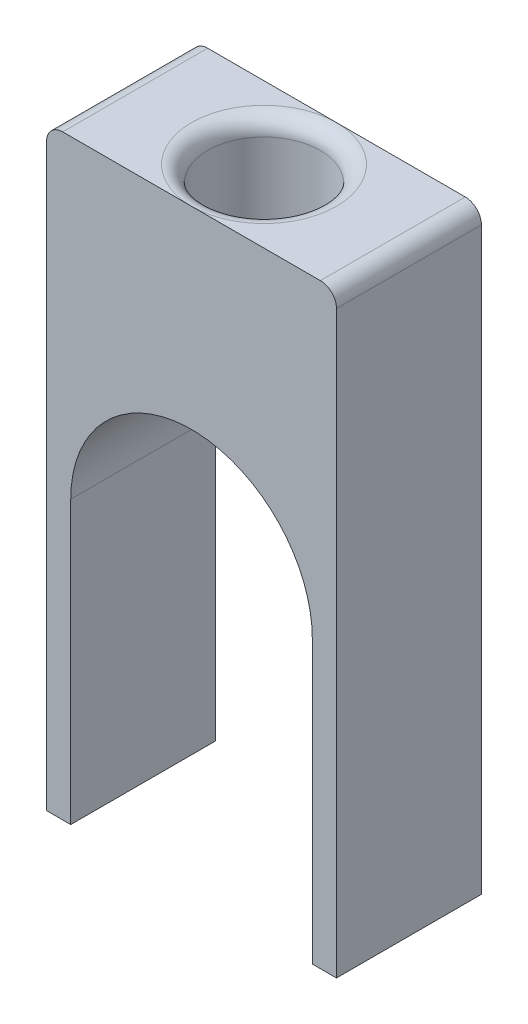
from build123d import *

# Parameters (mm, degrees)
BOSS_EXTRUDE1_DEPTH     = 18
CUT_EXTRUDE1_REACH      = 86.238
CUT_EXTRUDE1_END_RADIUS = 15
SKETCH3_R               = 7
FILLET1_R               = 2
FILLET2_R               = 2


with BuildPart() as part:
    # Sketch2 → Boss-Extrude1 (new body)
    with BuildSketch(Plane.XY):
        with BuildLine():
            Line((-33.38706816, 74), (-36, 74))
            Line((-36, 74), (-36, 0))
            Line((-36, 0), (-33, 0))
            Line((-33, 0), (-33, 35))
            ThreePointArc((-33, 35), (-18, 50), (-3, 35))
            Line((-3, 35), (-3, 0))
            Line((-3, 0), (0, 0))
            Line((0, 0), (0, 74))
            Line((0, 74), (-12.61679677, 74))
            Line((-12.61679677, 74), (-33.38706816, 74))
        make_face()
    extrude(amount=BOSS_EXTRUDE1_DEPTH)

    # Cut-Extrude1: up to this cylinder (the profile starts outside it)
    cut_extrude1_end = Plane(origin=(-18, 35, 9), z_dir=(0, 0, -1)) * Cylinder(CUT_EXTRUDE1_END_RADIUS, 203.476, mode=Mode.PRIVATE)
    # Sketch3 → Cut-Extrude1 (cut, up to the surface)
    with BuildSketch(Plane(origin=(0, 74, 0), x_dir=(1, 0, 0), z_dir=(0, 1, 0)), mode=Mode.PRIVATE) as cut_extrude1_sk1:
        with Locations(Location((-18, -9, 0), (0, 0, 270))):
            Circle(SKETCH3_R)
    cut_extrude1_tool1 = extrude(cut_extrude1_sk1.sketch, amount=-CUT_EXTRUDE1_REACH, mode=Mode.PRIVATE) - cut_extrude1_end
    add(cut_extrude1_tool1.solids().sort_by_distance((-18, 74, 9))[0], mode=Mode.SUBTRACT)

    # Fillet1
    fillet1_edges = [part.edges().sort_by_distance(p)[0] for p in [
        (-18, 74, 2),
    ]]
    fillet(fillet1_edges, radius=FILLET1_R - 0.0001)  # a hair under: the kernel refuses the full size

    # Fillet2
    fillet2_edges = [part.edges().sort_by_distance(p)[0] for p in [
        (-36, 74, 9),
        (0, 74, 9),
    ]]
    fillet(fillet2_edges, radius=FILLET2_R)


solid = part.part
